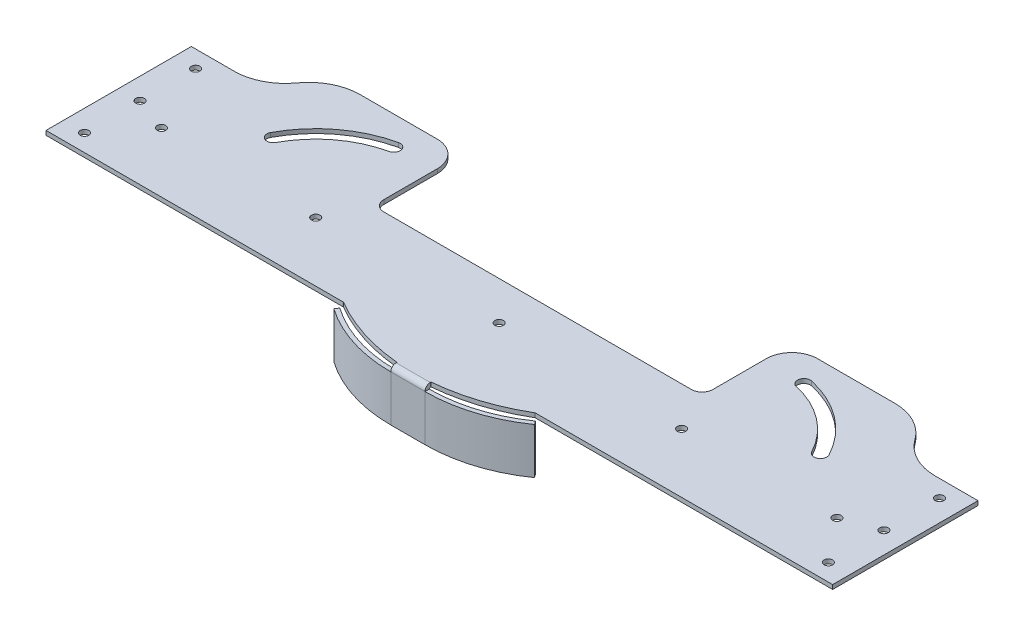
from build123d import *

# Parameters (mm, degrees)
SKETCH1_W          = 584.2
SKETCH1_H          = 304.8
BASE_FLANGE1_DEPTH = 3.175
SKETCH6_R          = 3.175
CUT_EXTRUDE1_DEPTH = 340.318162239
CUT_EXTRUDE2_DEPTH = 340.318162239
EDGE_FLANGE1_DEPTH = 25.4
HEM1_START         = -38.1
HEM1_DEPTH         = 34.1884
FILLET1_R          = 1.5875
SKETCH16_R         = 3.175
CUT_EXTRUDE3_DEPTH = 328.883956385
CUT_EXTRUDE4_DEPTH = 328.883956385
FILLET3_R          = 19.05


# Read off the part's stored shape, not the designer's step: Hem1
# Sheet-metal steps are written as plain solids
with BuildPart() as part:
    # Sketch1 → Base-Flange1 (new body)
    with BuildSketch(Plane(origin=(0, 0, 0), x_dir=(1, 0, 0), z_dir=(0, 1, 0))):
        with Locations((0, -20.239290429)):
            Rectangle(SKETCH1_W, SKETCH1_H)
    extrude(amount=-BASE_FLANGE1_DEPTH)

    # Sketch6 → Cut-Extrude1 (cut, through all)
    with BuildSketch(Plane(origin=(0, 0, 0), x_dir=(1, 0, 0), z_dir=(0, 1, 0))):
        with Locations(Location((-135.858839885, -76.581, 0), (0, 0, 270))):
            Circle(SKETCH6_R)
        with Locations(Location((135.858839885, -76.581, 0), (0, 0, 90))):
            Circle(SKETCH6_R)
        with BuildLine():
            ThreePointArc((-153.343024391, 2.471069539), (-184.826505048, -12.105468402), (-207.318024391, -38.521686343))
            ThreePointArc((-207.318024391, -38.521686343), (-205.353326106, -44.963950941), (-198.911061508, -42.999252655))
            ThreePointArc((-198.911061508, -42.999252655), (-179.065603264, -19.690825061), (-151.286061508, -6.829173936))
            ThreePointArc((-151.286061508, -6.829173936), (-147.664421212, -1.150570757), (-153.343024391, 2.471069539))
        make_face()
        with BuildLine():
            ThreePointArc((153.343024391, 2.471069539), (184.826505048, -12.105468402), (207.318024391, -38.521686343))
            ThreePointArc((207.318024391, -38.521686343), (205.353326106, -44.963950941), (198.911061508, -42.999252655))
            ThreePointArc((198.911061508, -42.999252655), (179.065603264, -19.690825061), (151.286061508, -6.829173936))
            ThreePointArc((151.286061508, -6.829173936), (147.664421212, -1.150570757), (153.343024391, 2.471069539))
        make_face()
    extrude(amount=-CUT_EXTRUDE1_DEPTH, mode=Mode.SUBTRACT)

    # Sketch7 → Cut-Extrude2 (cut, through all)
    with BuildSketch(Plane(origin=(0, 0, 0), x_dir=(1, 0, 0), z_dir=(0, 1, 0))):
        with BuildLine():
            Line((292.1, -120.65), (260.35, -120.65))
            Line((260.35, -120.65), (71.177693563, -120.65))
            ThreePointArc((71.177693563, -120.65), (42.985302493, -133.322729985), (12.7, -139.504109477))
            Line((12.7, -139.504109477), (12.7, -140.081))
            Line((12.7, -140.081), (-12.7, -140.081))
            Line((-12.7, -140.081), (-12.7, -139.504109477))
            ThreePointArc((-12.7, -139.504109477), (-42.985302493, -133.322729985), (-71.177693563, -120.65))
            Line((-71.177693563, -120.65), (-260.35, -120.65))
            Line((-260.35, -120.65), (-292.1, -120.65))
            Line((-292.1, -120.65), (-292.1, -172.639290429))
            Line((-292.1, -172.639290429), (292.1, -172.639290429))
            Line((292.1, -172.639290429), (292.1, -120.65))
        make_face()
        with BuildLine():
            Line((260.35, -12.7), (292.1, -12.7))
            Line((292.1, -12.7), (292.1, 132.160709571))
            Line((292.1, 132.160709571), (-292.1, 132.160709571))
            Line((-292.1, 132.160709571), (-292.1, -12.7))
            Line((-292.1, -12.7), (-260.35, -12.7))
            ThreePointArc((-260.35, -12.7), (-242.959808799, -8.49972345), (-229.403927955, 3.175))
            ThreePointArc((-229.403927955, 3.175), (-215.848047111, 14.84972345), (-198.45785591, 19.05))
            Line((-198.45785591, 19.05), (198.45785591, 19.05))
            ThreePointArc((198.45785591, 19.05), (215.848047111, 14.84972345), (229.403927955, 3.175))
            ThreePointArc((229.403927955, 3.175), (242.959808799, -8.49972345), (260.35, -12.7))
        make_face()
    extrude(amount=-CUT_EXTRUDE2_DEPTH, mode=Mode.SUBTRACT)

    # Edge-Flange1 section (across the edge) → Edge-Flange1 (add)
    with BuildSketch(Plane(origin=(12.7, -3.175, 140.8176), x_dir=(0, 0, -1), z_dir=(-1, 0, 0))):
        with BuildLine():
            Line((-3.175, 0.7366), (-3.175, 34.925))
            Line((-3.175, 34.925), (0, 34.925))
            Line((0, 34.925), (0, 0.7366))
            ThreePointArc((0, 0.7366), (0.215745145, 0.215745145), (0.7366, 0))
            Line((0.7366, 0), (0.7366, -3.175))
            ThreePointArc((0.7366, -3.175), (-2.029318885, -2.029318885), (-3.175, 0.7366))
        make_face()
    extrude(amount=EDGE_FLANGE1_DEPTH)

    # Hem1 outline → Hem1 (add)
    with BuildSketch(Plane(origin=(0, 0, 0), x_dir=(1, 0, 0), z_dir=(0, 1, 0)).offset(HEM1_START)):
        with BuildLine():
            Line((-72.650782704, -121.915190821), (-74.471887889, -124.515998562))
            ThreePointArc((-74.471887889, -124.515998562), (-45.084811783, -139.008100728), (-12.7, -143.9926))
            Line((-12.7, -143.9926), (-12.7, -140.8176))
            ThreePointArc((-12.7, -140.8176), (-44.13007087, -135.980049409), (-72.650782704, -121.915190821))
        make_face()
        with BuildLine():
            Line((74.471887889, -124.515998562), (72.650782704, -121.915190821))
            ThreePointArc((72.650782704, -121.915190821), (44.13007087, -135.980049409), (12.7, -140.8176))
            Line((12.7, -140.8176), (12.7, -143.9926))
            ThreePointArc((12.7, -143.9926), (45.084811783, -139.008100728), (74.471887889, -124.515998562))
        make_face()
    extrude(amount=HEM1_DEPTH)

    # Fillet1
    fillet1_edges = [part.edges().sort_by_distance(p)[0] for p in [
        (-71.177693563, -1.5875, 120.65),
        (71.177693563, -1.5875, 120.65),
    ]]
    fillet(fillet1_edges, radius=FILLET1_R)

    # Sketch16 → Cut-Extrude3 (cut, through all)
    with BuildSketch(Plane(origin=(0, 0, 0), x_dir=(1, 0, 0), z_dir=(0, 1, 0))):
        with Locations(Location((0, -76.2, 0), (0, 0, 270))):
            Circle(SKETCH16_R)
        with Locations(Location((-276.225, -25.4, 0), (0, 0, 270))):
            Circle(SKETCH16_R)
        with Locations(Location((-276.225, -107.95, 0), (0, 0, 270))):
            Circle(SKETCH16_R)
        with Locations(Location((-250.825, -76.2, 0), (0, 0, 270))):
            Circle(SKETCH16_R)
        with Locations(Location((276.225, -66.675, 0), (0, 0, 270))):
            Circle(SKETCH16_R)
        with Locations(Location((-276.225, -66.675, 0), (0, 0, 270))):
            Circle(SKETCH16_R)
        with Locations(Location((276.225, -107.95, 0), (0, 0, 270))):
            Circle(SKETCH16_R)
        with Locations(Location((276.225, -25.4, 0), (0, 0, 270))):
            Circle(SKETCH16_R)
        with Locations(Location((250.825, -76.2, 0), (0, 0, 270))):
            Circle(SKETCH16_R)
    extrude(amount=-CUT_EXTRUDE3_DEPTH, mode=Mode.SUBTRACT)

    # Sketch17 → Cut-Extrude4 (cut, through all)
    with BuildSketch(Plane(origin=(0, 0, 0), x_dir=(1, 0, 0), z_dir=(0, 1, 0))):
        with BuildLine():
            Line((-122.152042949, 19.05), (122.152042949, 19.05))
            Line((122.152042949, 19.05), (122.152042949, -39.6875))
            ThreePointArc((122.152042949, -39.6875), (119.827203025, -45.300160076), (114.214542949, -47.625))
            Line((114.214542949, -47.625), (-114.214542949, -47.625))
            ThreePointArc((-114.214542949, -47.625), (-119.827203025, -45.300160076), (-122.152042949, -39.6875))
            Line((-122.152042949, -39.6875), (-122.152042949, 19.05))
        make_face()
    extrude(amount=-CUT_EXTRUDE4_DEPTH, mode=Mode.SUBTRACT)

    # Fillet3
    fillet3_edges = [part.edges().sort_by_distance(p)[0] for p in [
        (122.152042949, -1.5875, -19.05),
        (-122.152042949, -1.5875, -19.05),
    ]]
    fillet(fillet3_edges, radius=FILLET3_R)


solid = part.part
